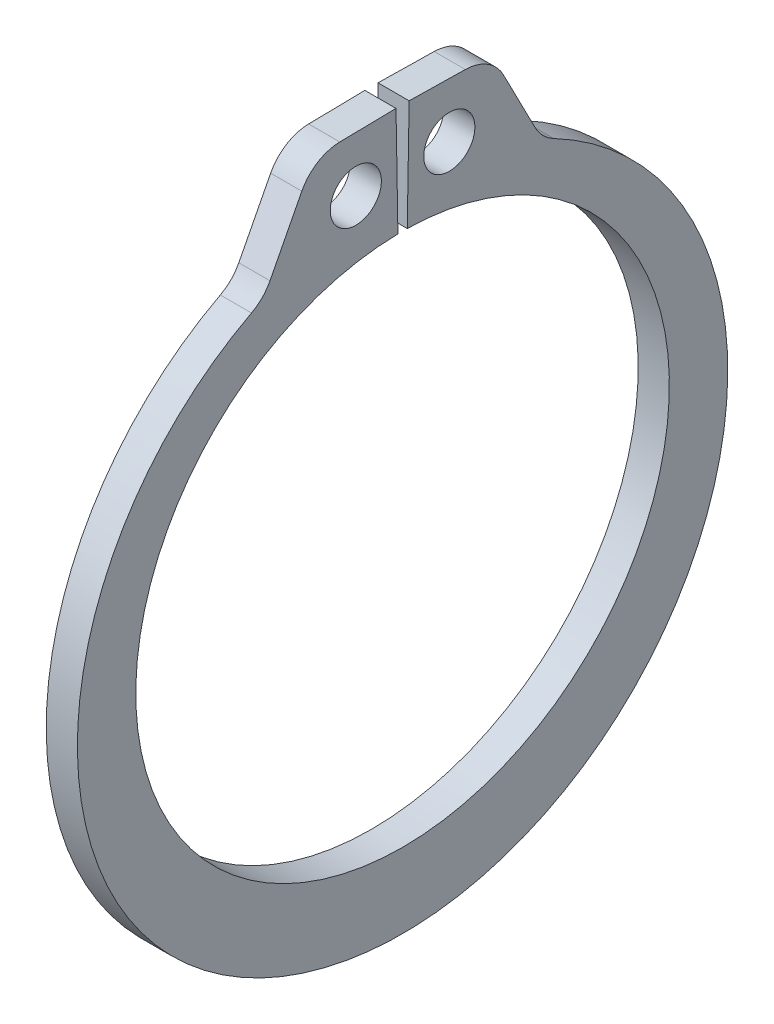
from build123d import *

# Parameters (mm, degrees)
SKETCH1_R      = 0.5207
EXTRUDE1_DEPTH = 0.3175
FILLET1_R      = 0.889


with BuildPart() as part:
    # Sketch1 → Extrude1 (new, symmetric)
    with BuildSketch(Plane(origin=(0, 0, 0), x_dir=(0, 0, -1), z_dir=(1, 0, 0))):
        with BuildLine():
            Line((-0.0948643, 5.434772132), (-0.133873919, 7.6696317))
            Line((-0.133873919, 7.6696317), (-1.810018595, 7.640374486))
            Line((-1.810018595, 7.640374486), (-2.834582122, 5.653822543))
            ThreePointArc((-2.834582122, 5.653822543), (0, -6.9596), (2.834582122, 5.653822543))
            Line((2.834582122, 5.653822543), (1.810018595, 7.640374486))
            Line((1.810018595, 7.640374486), (0.133873919, 7.6696317))
            Line((0.133873919, 7.6696317), (0.0948643, 5.434772132))
            ThreePointArc((0.0948643, 5.434772132), (0, -5.4356), (-0.0948643, 5.434772132))
        make_face()
        with Locations((-0.952441448, 6.537573309)):
            Circle(SKETCH1_R, mode=Mode.SUBTRACT)
        with Locations((0.952441448, 6.537573309)):
            Circle(SKETCH1_R, mode=Mode.SUBTRACT)
    extrude(amount=EXTRUDE1_DEPTH, both=True)

    # Fillet1
    fillet1_edges = [part.edges().sort_by_distance(p)[0] for p in [
        (0, 5.653822543, 2.834582122),
        (0, 5.653822543, -2.834582122),
        (0, 7.640374486, 1.810018595),
        (0, 7.640374486, -1.810018595),
    ]]
    fillet(fillet1_edges, radius=FILLET1_R)


solid = part.part
